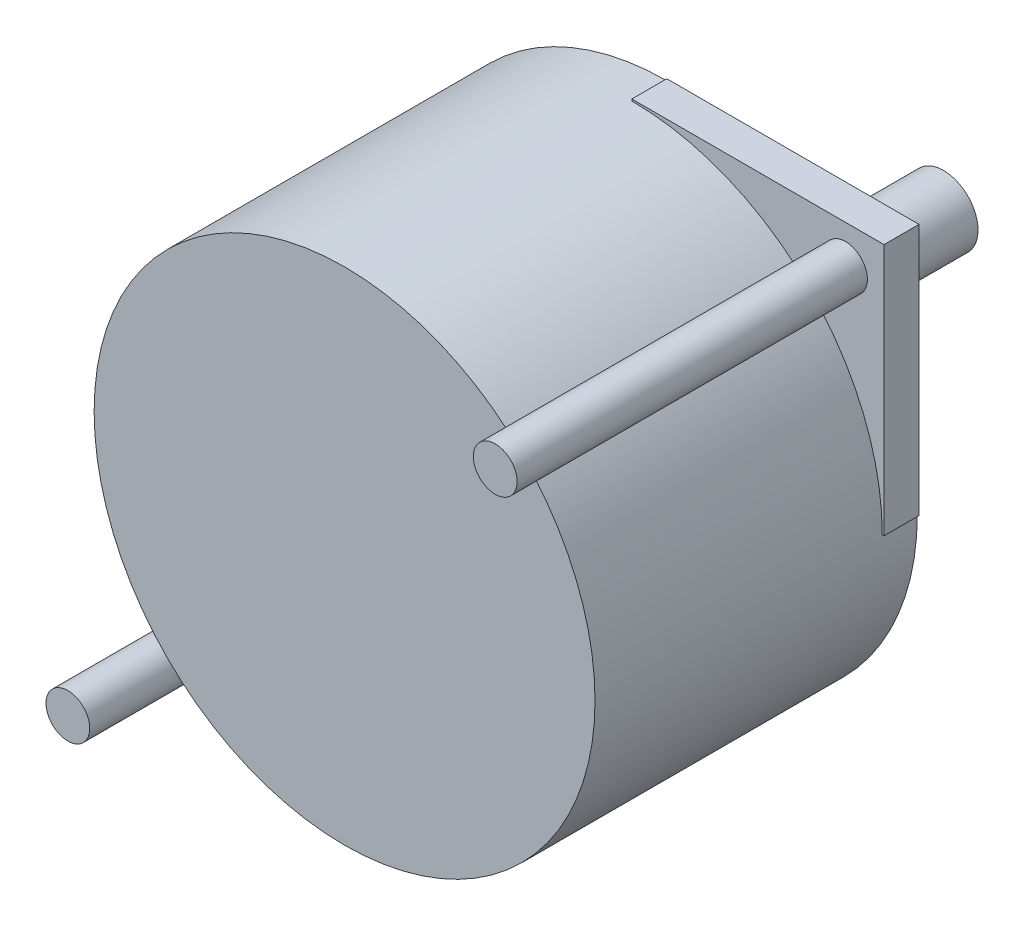
from build123d import *
from build123d.topology import SkipClean

# Parameters (mm, degrees)
SKETCH1_W           = 36.576
SKETCH1_H           = 36.576
BOSS_EXTRUDE1_DEPTH = 2.54
SKETCH2_R           = 1.5875
BOSS_EXTRUDE2_DEPTH = 25.4
CUT_EXTRUDE4_DEPTH  = 57.624372731
SKETCH4_R           = 8.001
BOSS_EXTRUDE3_DEPTH = 1.016
SKETCH5_R           = 2.49555
BOSS_EXTRUDE4_DEPTH = 19.05
BOSS_EXTRUDE5_START = 20.828
SKETCH6_R           = 18.161
BOSS_EXTRUDE5_DEPTH = 20.828


with BuildPart() as part:
    # Sketch1 → Boss-Extrude1 (new body)
    with BuildSketch(Plane.XY):
        with Locations((17.649916168, -17.343808383)):
            Rectangle(SKETCH1_W, SKETCH1_H)
    extrude(amount=BOSS_EXTRUDE1_DEPTH)

    # Sketch2 → Boss-Extrude2 (add)
    with BuildSketch(Plane.XY.offset(2.54)):
        with Locations((33.143916168, -1.849808383)):
            Circle(SKETCH2_R)
        with Locations((2.155916168, -32.837808383)):
            Circle(SKETCH2_R)
    extrude(amount=BOSS_EXTRUDE2_DEPTH)

    # Sketch3 → Cut-Extrude4 (cut, through all)
    with BuildSketch(Plane.XY.offset(2.54)):
        with BuildLine():
            Line((-0.638083832, 0.944191617), (-0.638083832, -17.343808383))
            Line((-0.638083832, -17.343808383), (-0.511083832, -17.343808383))
            ThreePointArc((-0.511083832, -17.343808383), (4.808149915, -4.50204213), (17.649916168, 0.817191617))
            Line((17.649916168, 0.817191617), (17.649916168, 0.944191617))
            Line((17.649916168, 0.944191617), (-0.638083832, 0.944191617))
        make_face()
        with BuildLine():
            Line((35.937916168, -35.631808383), (17.649916168, -35.631808383))
            Line((17.649916168, -35.631808383), (17.649916168, -35.504808383))
            ThreePointArc((17.649916168, -35.504808383), (30.491682421, -30.185574636), (35.810916168, -17.343808383))
            Line((35.810916168, -17.343808383), (35.937916168, -17.343808383))
            Line((35.937916168, -17.343808383), (35.937916168, -35.631808383))
        make_face()
    extrude(amount=-CUT_EXTRUDE4_DEPTH, mode=Mode.SUBTRACT)

    # Sketch4 → Boss-Extrude3 (add)
    with BuildSketch(Plane(origin=(0, 0, 0), x_dir=(-1, 0, 0), z_dir=(0, 0, -1))):
        with Locations((-17.649916168, -17.343808383)):
            Circle(SKETCH4_R)
    extrude(amount=BOSS_EXTRUDE3_DEPTH)

    # Sketch5 → Boss-Extrude4 (add)
    with BuildSketch(Plane(origin=(0, 0, -1.016), x_dir=(-1, 0, 0), z_dir=(0, 0, -1))):
        with Locations((-17.649916168, -17.343808383)):
            Circle(SKETCH5_R)
    extrude(amount=BOSS_EXTRUDE4_DEPTH)

    # Sketch6 → Boss-Extrude5 (add)
    with SkipClean():  # the faces are left unmerged after this step: merging them gives an invalid solid
        with BuildSketch(Plane.XY.offset(2.54).offset(BOSS_EXTRUDE5_START)):
            with Locations((17.649916168, -17.343808383)):
                Circle(SKETCH6_R)
        extrude(amount=-BOSS_EXTRUDE5_DEPTH)


solid = part.part
